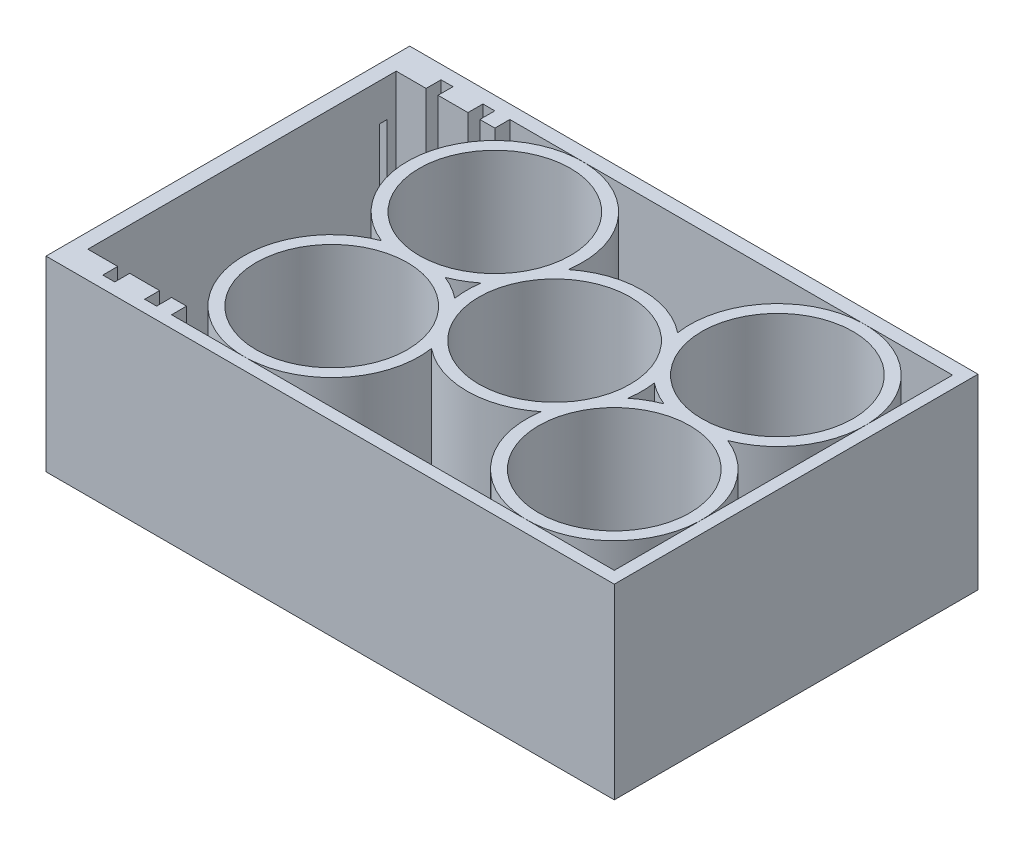
from build123d import *

# Parameters (mm, degrees)
SKETCH1_R             = 10.115000047
BOSS_EXTRUDE4_DEPTH   = 25
SKETCH1_W             = 76.040669035
SKETCH1_H             = 48.666950676
BOSS_EXTRUDE4_2_DEPTH = 25
SKETCH1_9_R           = 10.115000047
CUT_EXTRUDE1_DEPTH    = 36
SKETCH4_W             = 1
SKETCH4_H             = 15
CUT_EXTRUDE3_DEPTH    = 3
SKETCH5_W             = 38.666950676
SKETCH5_H             = 15
CUT_EXTRUDE4_DEPTH    = 0.5


with BuildPart() as part:
    # Sketch1 → Boss-Extrude4 (new body)
    with BuildSketch(Plane(origin=(0, 0, 0), x_dir=(1, 0, 0), z_dir=(0, 1, 0))):
        with BuildLine():
            ThreePointArc((22.33335059, 40.941406253), (13.444930876, 36.857737704), (10.753243591, 27.45373997))
            ThreePointArc((10.753243591, 27.45373997), (3.42801602, 30.026406253), (-3.897211552, 27.45373997))
            ThreePointArc((-3.897211552, 27.45373997), (-6.588898838, 36.857737705), (-15.477318554, 40.941406253))
            ThreePointArc((-15.477318554, 40.941406253), (-26.990581515, 31.391123299), (-19.732197967, 18.3114063))
            ThreePointArc((-19.732197967, 18.3114063), (-26.990581514, 5.231689296), (-15.477318545, -4.318593653))
            ThreePointArc((-15.477318545, -4.318593653), (-6.588898835, -0.234925102), (-3.897211552, 9.16907263))
            ThreePointArc((-3.897211552, 9.16907263), (3.42801602, 6.596406347), (10.753243591, 9.16907263))
            ThreePointArc((10.753243591, 9.16907263), (13.444930875, -0.234925102), (22.333350586, -4.318593653))
            ThreePointArc((22.333350586, -4.318593653), (30.617106493, -0.887349608), (34.048350537, 7.3964063))
            ThreePointArc((34.048350537, 7.3964063), (32.005142976, 14.006826546), (26.588230006, 18.3114063))
            ThreePointArc((26.588230006, 18.3114063), (32.005142976, 22.615986054), (34.048350537, 29.2264063))
            ThreePointArc((34.048350537, 29.2264063), (30.617106494, 37.510162206), (22.33335059, 40.941406253))
        make_face()
        with Locations((22.333350584, 29.2264063)):
            Circle(SKETCH1_R, mode=Mode.SUBTRACT)
        with BuildLine():
            ThreePointArc((15.008123013, 20.08407263), (16.475850608, 19.080918735), (18.078471162, 18.3114063))
            ThreePointArc((18.078471162, 18.3114063), (16.475850608, 17.541893865), (15.008123013, 16.53873997))
            ThreePointArc((15.008123013, 16.53873997), (15.143015973, 18.3114063), (15.008123013, 20.08407263))
        make_face(mode=Mode.SUBTRACT)
        with Locations((22.333350584, 7.3964063)):
            Circle(SKETCH1_R, mode=Mode.SUBTRACT)
        with BuildLine():
            ThreePointArc((-8.152090974, 16.53873997), (-9.619818569, 17.541893865), (-11.222439123, 18.3114063))
            ThreePointArc((-11.222439123, 18.3114063), (-9.619818569, 19.080918735), (-8.152090974, 20.08407263))
            ThreePointArc((-8.152090974, 20.08407263), (-8.286983933, 18.3114063), (-8.152090974, 16.53873997))
        make_face(mode=Mode.SUBTRACT)
        with Locations((-15.477318545, 7.3964063)):
            Circle(SKETCH1_R, mode=Mode.SUBTRACT)
    extrude(amount=BOSS_EXTRUDE4_DEPTH)

    # Sketch1<9> → Cut-Extrude1 (cut)
    with BuildSketch(Plane(origin=(0, 0, 0), x_dir=(1, 0, 0), z_dir=(0, 1, 0))):
        with Locations((3.42801602, 18.3114063)):
            Circle(SKETCH1_9_R)
        with Locations((-15.477318545, 29.2264063)):
            Circle(SKETCH1_9_R)
    extrude(amount=CUT_EXTRUDE1_DEPTH, mode=Mode.SUBTRACT)


with BuildPart() as body_2:
    # Sketch1 → Boss-Extrude4 2 (new body)
    with BuildSketch(Plane(origin=(0, 0, 0), x_dir=(1, 0, 0), z_dir=(0, 1, 0))):
        with Locations((-2.371983981, 18.414881685)):
            Rectangle(SKETCH1_W, SKETCH1_H)
        Polygon((-25.192318498, 38.941406253), (-25.192318498, 40.941406253), (-15.477318554, 40.941406253), (22.33335059, 40.941406253), (34.048350537, 40.941406253), (34.048350537, 29.2264063), (34.048350537, 7.3964063), (34.048350537, -4.318593653), (22.333350586, -4.318593653), (-15.477318545, -4.318593653), (-25.192318498, -4.318593653), (-25.192318498, -2.318593653), (-27.192318498, -2.318593653), (-27.192318498, -4.318593653), (-28.792318498, -4.318593653), (-28.792318498, -2.318593653), (-32.792318498, -2.318593653), (-32.792318498, -4.318593653), (-34.392318498, -4.318593653), (-34.392318498, -2.318593653), (-38.392318498, -2.318593653), (-38.392318498, 38.941406253), (-34.392318498, 38.941406253), (-34.392318498, 40.941406253), (-32.792318498, 40.941406253), (-32.792318498, 38.941406253), (-28.792318498, 38.941406253), (-28.792318498, 40.941406253), (-27.192318498, 40.941406253), (-27.192318498, 38.941406253), align=None, mode=Mode.SUBTRACT)
    extrude(amount=BOSS_EXTRUDE4_2_DEPTH)

    # Sketch4 → Cut-Extrude3 (cut)
    with BuildSketch(Plane.ZY.offset(40.392318498)):
        with Locations((0.482034275, 12.5)):
            Rectangle(SKETCH4_W, SKETCH4_H)
        with Locations((-37.184916401, 12.5)):
            Rectangle(SKETCH4_W, SKETCH4_H)
    extrude(amount=-CUT_EXTRUDE3_DEPTH, mode=Mode.SUBTRACT)

    # Sketch5 → Cut-Extrude4 (cut)
    with BuildSketch(Plane.ZY.offset(40.392318498)):
        with Locations((-18.351441063, 12.5)):
            Rectangle(SKETCH5_W, SKETCH5_H)
    extrude(amount=-CUT_EXTRUDE4_DEPTH, mode=Mode.SUBTRACT)


solid = Compound([part.part, body_2.part])
